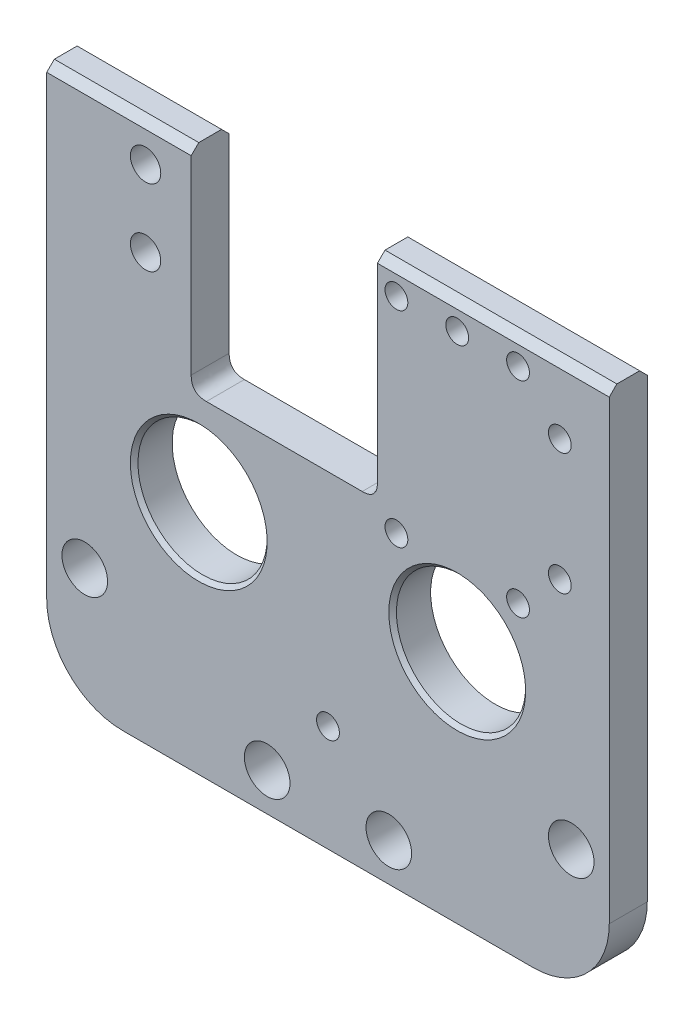
from build123d import *

# Parameters (mm, degrees)
SZKIC1_W                    = 54
SZKIC1_H                    = 71
DODANIE_WYCI_GNI_CIE1_DEPTH = 5
SZKIC2_W                    = 23.5
SZKIC2_H                    = 28
WYTNIJ_WYCI_GNI_CIE1_DEPTH  = 5
SZKIC3_W                    = 21
SZKIC3_H                    = 21
WYTNIJ_WYCI_GNI_CIE2_DEPTH  = 3
SZKIC4_R                    = 1.5
WYTNIJ_WYCI_GNI_CIE3_DEPTH  = 5
SZKIC5_W                    = 20
SZKIC5_H                    = 43
DODANIE_WYCI_GNI_CIE2_DEPTH = 5
SZKIC6_R                    = 8.5
WYTNIJ_WYCI_GNI_CIE4_DEPTH  = 5
SZKIC7_R                    = 3
WYTNIJ_WYCI_GNI_CIE5_DEPTH  = 10
ZAOKR_GLENIE3_R             = 10
SZKIC8_W                    = 19
SZKIC8_H                    = 28
DODANIE_WYCI_GNI_CIE3_DEPTH = 5
ZAOKR_GLENIE2_SIZE          = 2
SZKIC9_R                    = 2
WYTNIJ_WYCI_GNI_CIE6_DEPTH  = 10
SFAZOWANIE2_SIZE            = 1
SFAZOWANIE3_SIZE            = 0.5
SZKIC10_R                   = 1.5
WYTNIJ_WYCI_GNI_CIE7_DEPTH  = 10


with BuildPart() as part:
    # Szkic1 → Dodanie-wyciągnięcie1 (new body)
    with BuildSketch(Plane.XY):
        with Locations((7, 0.5)):
            Rectangle(SZKIC1_W, SZKIC1_H)
    extrude(amount=DODANIE_WYCI_GNI_CIE1_DEPTH)

    # Szkic2 → Wytnij-wyciągnięcie1 (cut)
    with BuildSketch(Plane.XY.offset(5)):
        with Locations((-8.25, 22)):
            Rectangle(SZKIC2_W, SZKIC2_H)
    extrude(amount=-WYTNIJ_WYCI_GNI_CIE1_DEPTH, mode=Mode.SUBTRACT)

    # Szkic3 → Wytnij-wyciągnięcie2 (cut)
    with BuildSketch(Plane(origin=(0, 0, 0), x_dir=(-1, 0, 0), z_dir=(0, 0, -1))):
        with Locations((-14, 20)):
            Rectangle(SZKIC3_W, SZKIC3_H)
    extrude(amount=-WYTNIJ_WYCI_GNI_CIE2_DEPTH, mode=Mode.SUBTRACT)

    # Szkic4 → Wytnij-wyciągnięcie3 (cut)
    with BuildSketch(Plane.XY.offset(5)):
        with Locations((6, 32.5)):
            Circle(SZKIC4_R)
        with Locations((14, 32.5)):
            Circle(SZKIC4_R)
        with Locations((22, 32.5)):
            Circle(SZKIC4_R)
        with Locations((22, 5.5)):
            Circle(SZKIC4_R)
        with Locations((6, 5.5)):
            Circle(SZKIC4_R)
        with Locations((27.5, 27)):
            Circle(SZKIC4_R)
        with Locations((27.5, 11)):
            Circle(SZKIC4_R)
    extrude(amount=-WYTNIJ_WYCI_GNI_CIE3_DEPTH, mode=Mode.SUBTRACT)

    # Szkic5 → Dodanie-wyciągnięcie2 (add)
    with BuildSketch(Plane.XY.offset(5)):
        with Locations((-30, -13.5)):
            Rectangle(SZKIC5_W, SZKIC5_H)
    extrude(amount=-DODANIE_WYCI_GNI_CIE2_DEPTH)

    # Szkic6 → Wytnij-wyciągnięcie4 (cut)
    with BuildSketch(Plane.XY.offset(5)):
        with Locations((-20, -4)):
            Circle(SZKIC6_R)
        with Locations((14, -4)):
            Circle(SZKIC6_R)
    extrude(amount=-WYTNIJ_WYCI_GNI_CIE4_DEPTH, mode=Mode.SUBTRACT)

    # Szkic7 → Wytnij-wyciągnięcie5 (cut)
    with BuildSketch(Plane.XY.offset(5)):
        with Locations((-11, -30)):
            Circle(SZKIC7_R)
        with Locations((5, -30)):
            Circle(SZKIC7_R)
        with Locations((-35, -19)):
            Circle(SZKIC7_R)
        with Locations((29, -19)):
            Circle(SZKIC7_R)
    extrude(amount=-WYTNIJ_WYCI_GNI_CIE5_DEPTH, mode=Mode.SUBTRACT)

    # Zaokrąglenie3
    zaokr_glenie3_edges = [part.edges().sort_by_distance(p)[0] for p in [
        (-40, -35, 2.5),
        (34, -35, 2.5),
    ]]
    fillet(zaokr_glenie3_edges, radius=ZAOKR_GLENIE3_R)

    # Szkic8 → Dodanie-wyciągnięcie3 (add)
    with BuildSketch(Plane.XY.offset(5)):
        with Locations((-30.5, 22)):
            Rectangle(SZKIC8_W, SZKIC8_H)
    extrude(amount=-DODANIE_WYCI_GNI_CIE3_DEPTH)

    # Zaokrąglenie2
    # a fillet whose section is not a circle: 2 mm, written as the material it adds along each edge
    with BuildSketch(Plane(origin=(3.5, 8, 5), x_dir=(0, 1, 0), z_dir=(0, 0, -1))) as zaokr_glenie2_piece_1_section:
        with BuildLine():
            Bezier((ZAOKR_GLENIE2_SIZE, 0), (0, 0), (0, -ZAOKR_GLENIE2_SIZE), weights=[1, 1, 1])
            Line((0, -ZAOKR_GLENIE2_SIZE), (0, 0))
            Line((0, 0), (ZAOKR_GLENIE2_SIZE, 0))
        make_face()
    zaokr_glenie2_piece_1 = extrude(amount=5, mode=Mode.PRIVATE)
    zaokr_glenie2_piece_1 = split(zaokr_glenie2_piece_1, bisect_by=Plane(origin=(3.5, 9.5, 5), z_dir=(0, 1, 0)), keep=Keep.TOP, mode=Mode.PRIVATE)
    zaokr_glenie2_piece_1 = split(zaokr_glenie2_piece_1, bisect_by=Plane(origin=(3.5, 8, 3), z_dir=(0, 0, 1)), keep=Keep.TOP, mode=Mode.PRIVATE)
    add(zaokr_glenie2_piece_1)
    with BuildSketch(Plane(origin=(3.5, 8, 5), x_dir=(0, 1, 0), z_dir=(0, 0, -1))) as zaokr_glenie2_piece_2_section:
        with BuildLine():
            Bezier((ZAOKR_GLENIE2_SIZE, 0), (0, 0), (0, -ZAOKR_GLENIE2_SIZE), weights=[1, 1, 1])
            Line((0, -ZAOKR_GLENIE2_SIZE), (0, 0))
            Line((0, 0), (ZAOKR_GLENIE2_SIZE, 0))
        make_face()
    zaokr_glenie2_piece_2 = extrude(amount=5, mode=Mode.PRIVATE)
    zaokr_glenie2_piece_2 = split(zaokr_glenie2_piece_2, bisect_by=Plane(origin=(3.5, 9.5, 5), z_dir=(0, -1, 0)), keep=Keep.TOP, mode=Mode.PRIVATE)
    zaokr_glenie2_piece_2 = split(zaokr_glenie2_piece_2, bisect_by=Plane(origin=(3.5, 8, 3), z_dir=(0, 0, 1)), keep=Keep.TOP, mode=Mode.PRIVATE)
    add(zaokr_glenie2_piece_2)
    with BuildSketch(Plane(origin=(3.5, 8, 5), x_dir=(0, 1, 0), z_dir=(0, 0, -1))) as zaokr_glenie2_piece_3_section:
        with BuildLine():
            Bezier((ZAOKR_GLENIE2_SIZE, 0), (0, 0), (0, -ZAOKR_GLENIE2_SIZE), weights=[1, 1, 1])
            Line((0, -ZAOKR_GLENIE2_SIZE), (0, 0))
            Line((0, 0), (ZAOKR_GLENIE2_SIZE, 0))
        make_face()
    zaokr_glenie2_piece_3 = extrude(amount=5, mode=Mode.PRIVATE)
    zaokr_glenie2_piece_3 = split(zaokr_glenie2_piece_3, bisect_by=Plane(origin=(3.5, 9.5, 5), z_dir=(0, -1, 0)), keep=Keep.TOP, mode=Mode.PRIVATE)
    zaokr_glenie2_piece_3 = split(zaokr_glenie2_piece_3, bisect_by=Plane(origin=(3.5, 8, 3), z_dir=(0, 0, -1)), keep=Keep.TOP, mode=Mode.PRIVATE)
    add(zaokr_glenie2_piece_3)
    with BuildSketch(Plane(origin=(-21, 8, 5), x_dir=(1, 0, 0), z_dir=(0, 0, -1))) as zaokr_glenie2_piece_4:
        with BuildLine():
            Bezier((ZAOKR_GLENIE2_SIZE, 0), (0, 0), (0, -ZAOKR_GLENIE2_SIZE), weights=[1, 1, 1])
            Line((0, -ZAOKR_GLENIE2_SIZE), (0, 0))
            Line((0, 0), (ZAOKR_GLENIE2_SIZE, 0))
        make_face()
    extrude(amount=5)

    # Szkic9 → Wytnij-wyciągnięcie6 (cut)
    with BuildSketch(Plane.XY.offset(5)):
        with Locations((-27, 31)):
            Circle(SZKIC9_R)
        with Locations((-27, 21)):
            Circle(SZKIC9_R)
    extrude(amount=-WYTNIJ_WYCI_GNI_CIE6_DEPTH, mode=Mode.SUBTRACT)

    # Sfazowanie2
    sfazowanie2_edges = [part.edges().sort_by_distance(p)[0] for p in [
        (-30.5, 36, 0),
        (-30.5, 36, 5),
        (18.75, 36, 5),
        (18.75, 36, 0),
    ]]
    chamfer(sfazowanie2_edges, length=SFAZOWANIE2_SIZE)

    # Sfazowanie3
    sfazowanie3_edges = [part.edges().sort_by_distance(p)[0] for p in [
        (-28.5, -4, 5),
        (5.5, -4, 5),
    ]]
    chamfer(sfazowanie3_edges, length=SFAZOWANIE3_SIZE)

    # Szkic10 → Wytnij-wyciągnięcie7 (cut)
    with BuildSketch(Plane.XY.offset(5)):
        with Locations((-3, -21)):
            Circle(SZKIC10_R)
    extrude(amount=-WYTNIJ_WYCI_GNI_CIE7_DEPTH, mode=Mode.SUBTRACT)


solid = part.part
